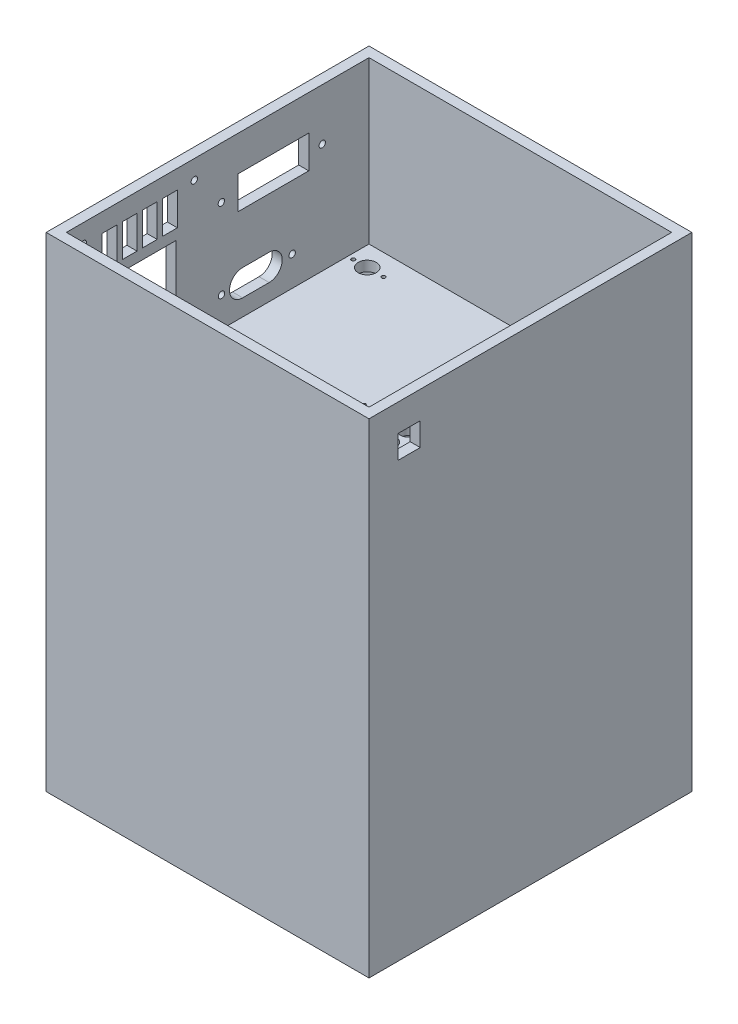
from build123d import *

# Parameters (mm, degrees)
SKETCH1_W           = 203.2
SKETCH1_H           = 203.2
BOSS_EXTRUDE1_DEPTH = 203.2
SHELL1_T            = -6.35
SKETCH4_W           = 203.2
SKETCH4_H           = 203.2
BOSS_EXTRUDE2_DEPTH = 101.6
SHELL2_START        = -95.25
SHELL2_OUTLINE_W    = 101.6
SHELL2_OUTLINE_H    = 190.5
SHELL2_DEPTH        = 190.5
CUT_EXTRUDE1_REACH  = 353.953
SKETCH5_R           = 2.012643391
SKETCH5_W           = 44.424354145
SKETCH5_H           = 20.611324099
SKETCH5_W_2         = 9.217895156
SKETCH5_H_2         = 20.611324098
SKETCH5_W_3         = 45.737629325
SKETCH5_H_3         = 57.494915659
SKETCH6_R           = 5.684938394
SKETCH6_R_2         = 1.168944227
SKETCH6_R_3         = 3.421939172
SKETCH6_R_4         = 5.101843958
CUT_EXTRUDE2_DEPTH  = 6.35
CUT_EXTRUDE3_START  = -6.35
SKETCH8_R           = 3.354405652
SKETCH8_R_2         = 5.101843958
CUT_EXTRUDE3_DEPTH  = 6.35
SKETCH9_W           = 14.019634769
SKETCH9_H           = 14.640004166
CUT_EXTRUDE4_DEPTH  = 6.35


# Read off the part's stored shape, not the designer's step: Shell2
with BuildPart() as part:
    # Sketch1 → Boss-Extrude1 (new body)
    with BuildSketch(Plane.XY):
        Rectangle(SKETCH1_W, SKETCH1_H)
    extrude(amount=BOSS_EXTRUDE1_DEPTH)

    # Shell1
    shell1_openings = [part.faces().sort_by_distance(p)[0] for p in [
        (-101.6, 0, 101.6),
    ]]
    offset(amount=SHELL1_T, openings=shell1_openings, kind=Kind.INTERSECTION)

    # Sketch4 → Boss-Extrude2 (add)
    with BuildSketch(Plane(origin=(0, 101.6, 0), x_dir=(1, 0, 0), z_dir=(0, 1, 0))):
        with Locations((0, -101.6)):
            Rectangle(SKETCH4_W, SKETCH4_H)
    extrude(amount=BOSS_EXTRUDE2_DEPTH)

    # Shell2 outline → Shell2 (cut)
    with BuildSketch(Plane.YZ.offset(SHELL2_START)):
        with Locations((152.4, 101.6)):
            Rectangle(SHELL2_OUTLINE_W, SHELL2_OUTLINE_H)
    extrude(amount=SHELL2_DEPTH, mode=Mode.SUBTRACT)

    # Sketch5 → Cut-Extrude1 (cut, up to next)
    with BuildSketch(Plane.ZY.offset(101.6), mode=Mode.PRIVATE) as cut_extrude1_sk1:
        with Locations((54.705408986, 120.3089464)):
            Circle(SKETCH5_R)
    cut_extrude1_tool1 = extrude(cut_extrude1_sk1.sketch, amount=-CUT_EXTRUDE1_REACH, mode=Mode.PRIVATE) & part.part
    # Sketch5 → Cut-Extrude1 (cut, up to next)
    with BuildSketch(Plane.ZY.offset(101.6), mode=Mode.PRIVATE) as cut_extrude1_sk2:
        with Locations((99.155408986, 120.3089464)):
            Circle(SKETCH5_R)
    cut_extrude1_tool2 = extrude(cut_extrude1_sk2.sketch, amount=-CUT_EXTRUDE1_REACH, mode=Mode.PRIVATE) & part.part
    # Sketch5 → Cut-Extrude1 (cut, up to next)
    with BuildSketch(Plane.ZY.offset(101.6), mode=Mode.PRIVATE) as cut_extrude1_sk3:
        with Locations((35.786561109, 170.760416659)):
            Circle(SKETCH5_R)
    cut_extrude1_tool3 = extrude(cut_extrude1_sk3.sketch, amount=-CUT_EXTRUDE1_REACH, mode=Mode.PRIVATE) & part.part
    # Sketch5 → Cut-Extrude1 (cut, up to next)
    with BuildSketch(Plane.ZY.offset(101.6), mode=Mode.PRIVATE) as cut_extrude1_sk4:
        with Locations((99.286561109, 170.760416659)):
            Circle(SKETCH5_R)
    cut_extrude1_tool4 = extrude(cut_extrude1_sk4.sketch, amount=-CUT_EXTRUDE1_REACH, mode=Mode.PRIVATE) & part.part
    # Sketch5 → Cut-Extrude1 (cut, up to next)
    with BuildSketch(Plane.ZY.offset(101.6), mode=Mode.PRIVATE) as cut_extrude1_sk5:
        with Locations((116.292296756, 191.371740757)):
            Circle(SKETCH5_R)
    cut_extrude1_tool5 = extrude(cut_extrude1_sk5.sketch, amount=-CUT_EXTRUDE1_REACH, mode=Mode.PRIVATE) & part.part
    # Sketch5 → Cut-Extrude1 (cut, up to next)
    with BuildSketch(Plane.ZY.offset(101.6), mode=Mode.PRIVATE) as cut_extrude1_sk6:
        with Locations((186.142296756, 191.371740757)):
            Circle(SKETCH5_R)
    cut_extrude1_tool6 = extrude(cut_extrude1_sk6.sketch, amount=-CUT_EXTRUDE1_REACH, mode=Mode.PRIVATE) & part.part
    # Sketch5 → Cut-Extrude1 (cut, up to next)
    with BuildSketch(Plane.ZY.offset(101.6), mode=Mode.PRIVATE) as cut_extrude1_sk7:
        with Locations((186.142296756, 108.821740757)):
            Circle(SKETCH5_R)
    cut_extrude1_tool7 = extrude(cut_extrude1_sk7.sketch, amount=-CUT_EXTRUDE1_REACH, mode=Mode.PRIVATE) & part.part
    # Sketch5 → Cut-Extrude1 (cut, up to next)
    with BuildSketch(Plane.ZY.offset(101.6), mode=Mode.PRIVATE) as cut_extrude1_sk8:
        with Locations((116.292296756, 108.821740757)):
            Circle(SKETCH5_R)
    cut_extrude1_tool8 = extrude(cut_extrude1_sk8.sketch, amount=-CUT_EXTRUDE1_REACH, mode=Mode.PRIVATE) & part.part
    # Sketch5 → Cut-Extrude1 (cut, up to next)
    with BuildSketch(Plane.ZY.offset(101.6), mode=Mode.PRIVATE) as cut_extrude1_sk9:
        with BuildLine():
            Line((69.224087642, 128.565727329), (85.896102012, 128.565727329))
            ThreePointArc((85.896102012, 128.565727329), (94.152882941, 120.3089464), (85.896102012, 112.052165471))
            Line((85.896102012, 112.052165471), (69.224087642, 112.052165471))
            ThreePointArc((69.224087642, 112.052165471), (60.967306712, 120.3089464), (69.224087642, 128.565727329))
        make_face()
    cut_extrude1_tool9 = extrude(cut_extrude1_sk9.sketch, amount=-CUT_EXTRUDE1_REACH, mode=Mode.PRIVATE) & part.part
    # Sketch5 → Cut-Extrude1 (cut, up to next)
    with BuildSketch(Plane.ZY.offset(101.6), mode=Mode.PRIVATE) as cut_extrude1_sk10:
        with Locations((66.474168139, 170.760416659)):
            Rectangle(SKETCH5_W, SKETCH5_H)
    cut_extrude1_tool10 = extrude(cut_extrude1_sk10.sketch, amount=-CUT_EXTRUDE1_REACH, mode=Mode.PRIVATE) & part.part
    # Sketch5 → Cut-Extrude1 (cut, up to next)
    with BuildSketch(Plane.ZY.offset(101.6), mode=Mode.PRIVATE) as cut_extrude1_sk11:
        with Locations((131.563917704, 181.066078708)):
            Rectangle(SKETCH5_W_2, SKETCH5_H_2)
    cut_extrude1_tool11 = extrude(cut_extrude1_sk11.sketch, amount=-CUT_EXTRUDE1_REACH, mode=Mode.PRIVATE) & part.part
    # Sketch5 → Cut-Extrude1 (cut, up to next)
    with BuildSketch(Plane.ZY.offset(101.6), mode=Mode.PRIVATE) as cut_extrude1_sk12:
        with Locations((144.263917704, 181.066078708)):
            Rectangle(SKETCH5_W_2, SKETCH5_H_2)
    cut_extrude1_tool12 = extrude(cut_extrude1_sk12.sketch, amount=-CUT_EXTRUDE1_REACH, mode=Mode.PRIVATE) & part.part
    # Sketch5 → Cut-Extrude1 (cut, up to next)
    with BuildSketch(Plane.ZY.offset(101.6), mode=Mode.PRIVATE) as cut_extrude1_sk13:
        with Locations((156.963917704, 181.066078708)):
            Rectangle(SKETCH5_W_2, SKETCH5_H_2)
    cut_extrude1_tool13 = extrude(cut_extrude1_sk13.sketch, amount=-CUT_EXTRUDE1_REACH, mode=Mode.PRIVATE) & part.part
    # Sketch5 → Cut-Extrude1 (cut, up to next)
    with BuildSketch(Plane.ZY.offset(101.6), mode=Mode.PRIVATE) as cut_extrude1_sk14:
        with Locations((169.663917704, 181.066078708)):
            Rectangle(SKETCH5_W_2, SKETCH5_H_2)
    cut_extrude1_tool14 = extrude(cut_extrude1_sk14.sketch, amount=-CUT_EXTRUDE1_REACH, mode=Mode.PRIVATE) & part.part
    # Sketch5 → Cut-Extrude1 (cut, up to next)
    with BuildSketch(Plane.ZY.offset(101.6), mode=Mode.PRIVATE) as cut_extrude1_sk15:
        with Locations((150.708498745, 135.532286769)):
            Rectangle(SKETCH5_W_3, SKETCH5_H_3)
    cut_extrude1_tool15 = extrude(cut_extrude1_sk15.sketch, amount=-CUT_EXTRUDE1_REACH, mode=Mode.PRIVATE) & part.part
    add(cut_extrude1_tool1.solids().sort_by_distance((-101.6, 120.308946, 54.705409))[0], mode=Mode.SUBTRACT)
    add(cut_extrude1_tool2.solids().sort_by_distance((-101.6, 120.308946, 99.155409))[0], mode=Mode.SUBTRACT)
    add(cut_extrude1_tool3.solids().sort_by_distance((-101.6, 170.760417, 35.786561))[0], mode=Mode.SUBTRACT)
    add(cut_extrude1_tool4.solids().sort_by_distance((-101.6, 170.760417, 99.286561))[0], mode=Mode.SUBTRACT)
    add(cut_extrude1_tool5.solids().sort_by_distance((-101.6, 191.371741, 116.292297))[0], mode=Mode.SUBTRACT)
    add(cut_extrude1_tool6.solids().sort_by_distance((-101.6, 191.371741, 186.142297))[0], mode=Mode.SUBTRACT)
    add(cut_extrude1_tool7.solids().sort_by_distance((-101.6, 108.821741, 186.142297))[0], mode=Mode.SUBTRACT)
    add(cut_extrude1_tool8.solids().sort_by_distance((-101.6, 108.821741, 116.292297))[0], mode=Mode.SUBTRACT)
    add(cut_extrude1_tool9.solids().sort_by_distance((-101.6, 120.308946, 77.560095))[0], mode=Mode.SUBTRACT)
    add(cut_extrude1_tool10.solids().sort_by_distance((-101.6, 170.760417, 66.474168))[0], mode=Mode.SUBTRACT)
    add(cut_extrude1_tool11.solids().sort_by_distance((-101.6, 181.066079, 131.563918))[0], mode=Mode.SUBTRACT)
    add(cut_extrude1_tool12.solids().sort_by_distance((-101.6, 181.066079, 144.263918))[0], mode=Mode.SUBTRACT)
    add(cut_extrude1_tool13.solids().sort_by_distance((-101.6, 181.066079, 156.963918))[0], mode=Mode.SUBTRACT)
    add(cut_extrude1_tool14.solids().sort_by_distance((-101.6, 181.066079, 169.663918))[0], mode=Mode.SUBTRACT)
    add(cut_extrude1_tool15.solids().sort_by_distance((-101.6, 135.532287, 150.708499))[0], mode=Mode.SUBTRACT)

    # Sketch6 → Cut-Extrude2 (cut)
    with BuildSketch(Plane(origin=(0, 101.6, 0), x_dir=(1, 0, 0), z_dir=(0, 1, 0))):
        with Locations(Location((-83.017143041, -19.715314022, 0), (0, 0, 270))):
            Circle(SKETCH6_R)
        with Locations(Location((-91.815675387, -19.715314022, 0), (0, 0, 270))):
            Circle(SKETCH6_R_2)
        with Locations(Location((-72.765675387, -19.715314022, 0), (0, 0, 270))):
            Circle(SKETCH6_R_2)
        with Locations(Location((-0.751231172, -80.424215332, 0), (0, 0, 270))):
            Circle(SKETCH6_R_3)
        with Locations(Location((9.408768828, -80.424215332, 0), (0, 0, 270))):
            Circle(SKETCH6_R_3)
        with Locations(Location((9.408768828, -70.264215332, 0), (0, 0, 270))):
            Circle(SKETCH6_R_3)
        with Locations(Location((-0.751231172, -70.264215332, 0), (0, 0, 270))):
            Circle(SKETCH6_R_3)
        with Locations(Location((18.774972205, -108.307591656, 0), (0, 0, 270))):
            Circle(SKETCH6_R_4)
        with Locations(Location((18.774972205, -95.607591656, 0), (0, 0, 270))):
            Circle(SKETCH6_R_4)
        with Locations(Location((-55.964041724, -146.313150067, 0), (0, 0, 270))):
            Circle(SKETCH6_R_2)
        with Locations(Location((-55.964041724, -127.263150067, 0), (0, 0, 270))):
            Circle(SKETCH6_R_2)
        with BuildLine():
            Line((-9.22943984, -94.303220023), (-38.017227148, -123.091007331))
            Line((-38.017227148, -123.091007331), (-39.959559127, -125.281063766))
            ThreePointArc((-39.959559127, -125.281063766), (-14.988079393, -139.234779576), (13.531345518, -141.453650414))
            Line((13.531345518, -141.453650414), (7.542325378, -98.429750531))
            ThreePointArc((7.542325378, -98.429750531), (-1.239895318, -97.977351676), (-9.22943984, -94.303220023))
        make_face()
    extrude(amount=-CUT_EXTRUDE2_DEPTH, mode=Mode.SUBTRACT)

    # Sketch8 → Cut-Extrude3 (cut)
    with BuildSketch(Plane.XZ.offset(101.6).offset(CUT_EXTRUDE3_START)):
        with Locations(Location((88.306637822, 190.608444055, 0), (0, 0, 270))):
            Circle(SKETCH8_R)
        with Locations(Location((-89.493362178, 190.608444055, 0), (0, 0, 270))):
            Circle(SKETCH8_R)
        with Locations(Location((18.774972205, 95.607591656, 0), (0, 0, 90))):
            Circle(SKETCH8_R_2)
        with Locations(Location((88.306637822, 12.808444055, 0), (0, 0, 270))):
            Circle(SKETCH8_R)
        with Locations(Location((-89.493362178, 12.808444055, 0), (0, 0, 270))):
            Circle(SKETCH8_R)
    extrude(amount=CUT_EXTRUDE3_DEPTH, mode=Mode.SUBTRACT)

    # Sketch9 → Cut-Extrude4 (cut)
    with BuildSketch(Plane(origin=(101.6, 0, 0), x_dir=(0, 0, -1), z_dir=(1, 0, 0))):
        with Locations((-177.956557016, 178.730851784)):
            Rectangle(SKETCH9_W, SKETCH9_H)
    extrude(amount=-CUT_EXTRUDE4_DEPTH, mode=Mode.SUBTRACT)


solid = part.part
